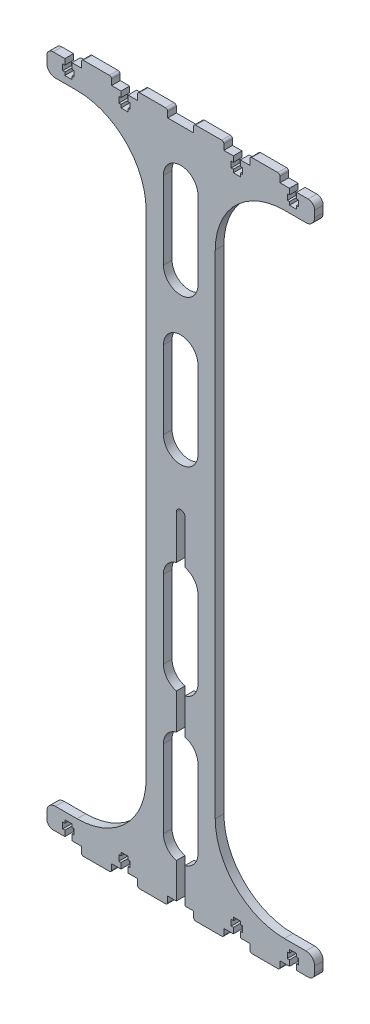
from build123d import *

# Parameters (mm, degrees)
BOSS_EXTRUDE1_DEPTH  = 10
SKETCH2_W            = 8.1
SKETCH2_H            = 27
SKETCH2_W_2          = 13.1
SKETCH2_H_2          = 6.8
CUT_EXTRUDE1_DEPTH   = 10
FILLET1_R            = 2.5
SKETCH3_W            = 115
SKETCH3_H            = 365
CUT_EXTRUDE2_DEPTH   = 429.165855715
FILLET2_R            = 80
FILLET3_R            = 10
FILLET4_R            = 7.5
FILLET1_OF_MIRROR1_R = 2.5
FILLET2_OF_MIRROR1_R = 80
FILLET3_OF_MIRROR1_R = 10
FILLET4_OF_MIRROR1_R = 7.5
MIRROR2_DEPTH        = 10
CUT_EXTRUDE3_DEPTH   = 429.165855715
SKETCH5_W            = 10
SKETCH5_H            = 395
CUT_EXTRUDE4_DEPTH   = 429.165855715
FILLET5_R            = 5


# Read off the part's stored shape, not the designer's step: Mirror2
with BuildPart() as part:
    # Sketch1 → Boss-Extrude1 (new body)
    with BuildSketch(Plane.XY):
        Polygon((80, -399), (115, -399), (115, -390), (155, -390), (155, 0), (0, 0), (0, -390), (15, -390), (15, -399), (50, -399), (50, -390), (80, -390), align=None)
    boss_extrude1 = extrude(amount=BOSS_EXTRUDE1_DEPTH)

    # Sketch2 → Cut-Extrude1 (cut)
    with BuildSketch(Plane.XY.offset(10)):
        with Locations((65, -386.5)):
            Rectangle(SKETCH2_W, SKETCH2_H)
        with Locations((130, -386.5)):
            Rectangle(SKETCH2_W, SKETCH2_H)
        with Locations((65, -380)):
            Rectangle(SKETCH2_W_2, SKETCH2_H_2)
        with Locations((130, -380)):
            Rectangle(SKETCH2_W_2, SKETCH2_H_2)
    cut_extrude1 = extrude(amount=-CUT_EXTRUDE1_DEPTH, mode=Mode.SUBTRACT)

    # Fillet1
    fillet1_edges = [part.edges().sort_by_distance(p)[0] for p in [
        (115, -399, 5),
        (80, -399, 5),
        (50, -399, 5),
        (15, -399, 5),
    ]]
    fillet(fillet1_edges, radius=FILLET1_R)

    # Sketch3 → Cut-Extrude2 (cut, through all)
    with BuildSketch(Plane.XY.offset(10)):
        with Locations((97.5, -182.5)):
            Rectangle(SKETCH3_W, SKETCH3_H)
    cut_extrude2 = extrude(amount=-CUT_EXTRUDE2_DEPTH, mode=Mode.SUBTRACT)

    # Fillet2
    fillet2_edges = [part.edges().sort_by_distance(p)[0] for p in [
        (40, -365, 5),
    ]]
    fillet(fillet2_edges, radius=FILLET2_R)

    # Fillet3
    fillet3_edges = [part.edges().sort_by_distance(p)[0] for p in [
        (155, -365, 5),
    ]]
    fillet(fillet3_edges, radius=FILLET3_R)

    # Fillet4
    fillet4_edges = [part.edges().sort_by_distance(p)[0] for p in [
        (155, -390, 5),
    ]]
    fillet(fillet4_edges, radius=FILLET4_R)

    # Mirror1: Boss-Extrude1, Cut-Extrude1, Cut-Extrude2 across plane
    add(boss_extrude1.mirror(Plane.ZX))
    add(cut_extrude1.mirror(Plane.ZX), mode=Mode.SUBTRACT)
    add(cut_extrude2.mirror(Plane.ZX), mode=Mode.SUBTRACT)

    # Fillet1 of Mirror1
    fillet1_of_mirror1_edges = [part.edges().sort_by_distance(p)[0] for p in [
        (115, 399, 5),
        (80, 399, 5),
        (50, 399, 5),
        (15, 399, 5),
    ]]
    fillet(fillet1_of_mirror1_edges, radius=FILLET1_OF_MIRROR1_R)

    # Fillet2 of Mirror1
    fillet2_of_mirror1_edges = [part.edges().sort_by_distance(p)[0] for p in [
        (40, 365, 5),
    ]]
    fillet(fillet2_of_mirror1_edges, radius=FILLET2_OF_MIRROR1_R)

    # Fillet3 of Mirror1
    fillet3_of_mirror1_edges = [part.edges().sort_by_distance(p)[0] for p in [
        (155, 365, 5),
    ]]
    fillet(fillet3_of_mirror1_edges, radius=FILLET3_OF_MIRROR1_R)

    # Fillet4 of Mirror1
    fillet4_of_mirror1_edges = [part.edges().sort_by_distance(p)[0] for p in [
        (155, 390, 5),
    ]]
    fillet(fillet4_of_mirror1_edges, radius=FILLET4_OF_MIRROR1_R)

    # Mirror2 outline → Mirror2 (add)
    with BuildSketch(Plane.XY):
        with BuildLine():
            ThreePointArc((-145, -365), (-152.071067812, -367.928932188), (-155, -375))
            Line((-155, -375), (-155, -382.5))
            ThreePointArc((-155, -382.5), (-152.803300859, -387.803300859), (-147.5, -390))
            Line((-147.5, -390), (-134.05, -390))
            Line((-134.05, -390), (-134.05, -383.4))
            Line((-134.05, -383.4), (-136.55, -383.4))
            Line((-136.55, -383.4), (-136.55, -376.6))
            Line((-136.55, -376.6), (-134.05, -376.6))
            Line((-134.05, -376.6), (-134.05, -373))
            Line((-134.05, -373), (-125.95, -373))
            Line((-125.95, -373), (-125.95, -376.6))
            Line((-125.95, -376.6), (-123.45, -376.6))
            Line((-123.45, -376.6), (-123.45, -383.4))
            Line((-123.45, -383.4), (-125.95, -383.4))
            Line((-125.95, -383.4), (-125.95, -390))
            Line((-125.95, -390), (-115, -390))
            Line((-115, -390), (-115, -396.5))
            ThreePointArc((-115, -396.5), (-114.267766953, -398.267766953), (-112.5, -399))
            Line((-112.5, -399), (-82.5, -399))
            ThreePointArc((-82.5, -399), (-80.732233047, -398.267766953), (-80, -396.5))
            Line((-80, -396.5), (-80, -390))
            Line((-80, -390), (-69.05, -390))
            Line((-69.05, -390), (-69.05, -383.4))
            Line((-69.05, -383.4), (-71.55, -383.4))
            Line((-71.55, -383.4), (-71.55, -376.6))
            Line((-71.55, -376.6), (-69.05, -376.6))
            Line((-69.05, -376.6), (-69.05, -373))
            Line((-69.05, -373), (-60.95, -373))
            Line((-60.95, -373), (-60.95, -376.6))
            Line((-60.95, -376.6), (-58.45, -376.6))
            Line((-58.45, -376.6), (-58.45, -383.4))
            Line((-58.45, -383.4), (-60.95, -383.4))
            Line((-60.95, -383.4), (-60.95, -390))
            Line((-60.95, -390), (-50, -390))
            Line((-50, -390), (-50, -396.5))
            ThreePointArc((-50, -396.5), (-49.267766953, -398.267766953), (-47.5, -399))
            Line((-47.5, -399), (-17.5, -399))
            ThreePointArc((-17.5, -399), (-15.732233047, -398.267766953), (-15, -396.5))
            Line((-15, -396.5), (-15, -390))
            Line((-15, -390), (0, -390))
            Line((0, -390), (0, 390))
            Line((0, 390), (-15, 390))
            Line((-15, 390), (-15, 396.5))
            ThreePointArc((-15, 396.5), (-15.732233047, 398.267766953), (-17.5, 399))
            Line((-17.5, 399), (-47.5, 399))
            ThreePointArc((-47.5, 399), (-49.267766953, 398.267766953), (-50, 396.5))
            Line((-50, 396.5), (-50, 390))
            Line((-50, 390), (-60.95, 390))
            Line((-60.95, 390), (-60.95, 383.4))
            Line((-60.95, 383.4), (-58.45, 383.4))
            Line((-58.45, 383.4), (-58.45, 376.6))
            Line((-58.45, 376.6), (-60.95, 376.6))
            Line((-60.95, 376.6), (-60.95, 373))
            Line((-60.95, 373), (-69.05, 373))
            Line((-69.05, 373), (-69.05, 376.6))
            Line((-69.05, 376.6), (-71.55, 376.6))
            Line((-71.55, 376.6), (-71.55, 383.4))
            Line((-71.55, 383.4), (-69.05, 383.4))
            Line((-69.05, 383.4), (-69.05, 390))
            Line((-69.05, 390), (-80, 390))
            Line((-80, 390), (-80, 396.5))
            ThreePointArc((-80, 396.5), (-80.732233047, 398.267766953), (-82.5, 399))
            Line((-82.5, 399), (-112.5, 399))
            ThreePointArc((-112.5, 399), (-114.267766953, 398.267766953), (-115, 396.5))
            Line((-115, 396.5), (-115, 390))
            Line((-115, 390), (-125.95, 390))
            Line((-125.95, 390), (-125.95, 383.4))
            Line((-125.95, 383.4), (-123.45, 383.4))
            Line((-123.45, 383.4), (-123.45, 376.6))
            Line((-123.45, 376.6), (-125.95, 376.6))
            Line((-125.95, 376.6), (-125.95, 373))
            Line((-125.95, 373), (-134.05, 373))
            Line((-134.05, 373), (-134.05, 376.6))
            Line((-134.05, 376.6), (-136.55, 376.6))
            Line((-136.55, 376.6), (-136.55, 383.4))
            Line((-136.55, 383.4), (-134.05, 383.4))
            Line((-134.05, 383.4), (-134.05, 390))
            Line((-134.05, 390), (-147.5, 390))
            ThreePointArc((-147.5, 390), (-152.803300859, 387.803300859), (-155, 382.5))
            Line((-155, 382.5), (-155, 375))
            ThreePointArc((-155, 375), (-152.071067812, 367.928932188), (-145, 365))
            Line((-145, 365), (-120, 365))
            ThreePointArc((-120, 365), (-63.431457505, 341.568542495), (-40, 285))
            Line((-40, 285), (-40, -285))
            ThreePointArc((-40, -285), (-63.431457505, -341.568542495), (-120, -365))
            Line((-120, -365), (-145, -365))
        make_face()
    extrude(amount=MIRROR2_DEPTH)

    # Sketch4 → Cut-Extrude3 (cut, through all)
    with BuildSketch(Plane.XY.offset(10)):
        with BuildLine():
            Line((20, 330), (20, 240))
            ThreePointArc((20, 240), (0, 220), (-20, 240))
            Line((-20, 240), (-20, 330))
            ThreePointArc((-20, 330), (0, 350), (20, 330))
        make_face()
        with BuildLine():
            Line((20, 160), (20, 70))
            ThreePointArc((20, 70), (0, 50), (-20, 70))
            Line((-20, 70), (-20, 160))
            ThreePointArc((-20, 160), (0, 180), (20, 160))
        make_face()
    cut_extrude3 = extrude(amount=-CUT_EXTRUDE3_DEPTH, mode=Mode.SUBTRACT)

    # Mirror3: Cut-Extrude3 across plane
    add(cut_extrude3.mirror(Plane.ZX), mode=Mode.SUBTRACT)

    # Sketch5 → Cut-Extrude4 (cut, through all)
    with BuildSketch(Plane.XY.offset(10)):
        with Locations((0, -192.5)):
            Rectangle(SKETCH5_W, SKETCH5_H)
    extrude(amount=-CUT_EXTRUDE4_DEPTH, mode=Mode.SUBTRACT)

    # Fillet5
    fillet5_edges = [part.edges().sort_by_distance(p)[0] for p in [
        (5, 5, 5),
        (-5, 5, 5),
    ]]
    fillet(fillet5_edges, radius=FILLET5_R - 0.0001)  # a hair under: the kernel refuses the full size


solid = part.part
